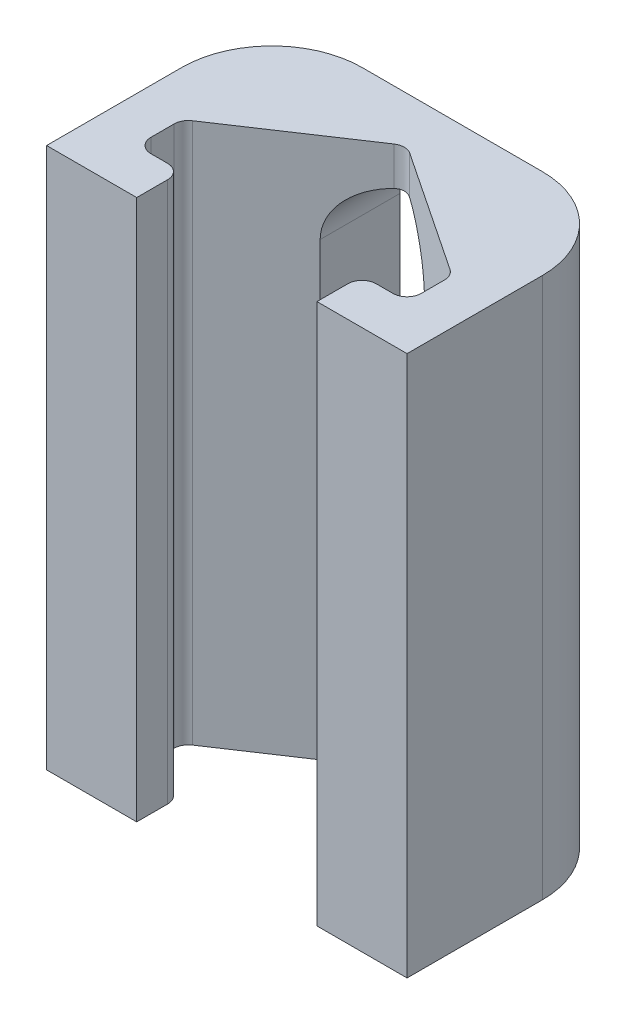
from build123d import *

# Parameters (mm, degrees)
BOSS_EXTRUDE1_DEPTH     = 127
BOSS_EXTRUDE2_DEPTH     = 38.1
FILLET1_R               = 1
CUT_EXTRUDE1_DEPTH      = 166.676690047
CUT_EXTRUDE1_DEPTH_BACK = 166.676690047


with BuildPart() as part:
    # Sketch2 → Boss-Extrude1 (new body)
    with BuildSketch(Plane.XY):
        with BuildLine():
            Line((-71.414284285, -70), (71.414284285, -70))
            ThreePointArc((71.414284285, -70), (0, -100), (-71.414284285, -70))
        make_face()
    extrude(amount=BOSS_EXTRUDE1_DEPTH)


with BuildPart() as body_2:
    # Sketch3 → Boss-Extrude2 (new body)
    with BuildSketch(Plane(origin=(0, 0, 0), x_dir=(1, 0, 0), z_dir=(0, 1, 0))):
        with BuildLine():
            Line((-52.364284285, -127), (-52.364284285, -117.475))
            ThreePointArc((-52.364284285, -117.475), (-50.504412346, -112.984871939), (-46.014284285, -111.125))
            Line((-46.014284285, -111.125), (-33.314284285, -111.125))
            ThreePointArc((-33.314284285, -111.125), (-28.824156225, -112.984871939), (-26.964284285, -117.475))
            Line((-26.964284285, -117.475), (-26.964284285, -127))
            Line((-26.964284285, -127), (-33.314284285, -127))
            Line((-33.314284285, -127), (-33.314284285, -123.825))
            Line((-33.314284285, -123.825), (-30.139284285, -123.825))
            Line((-30.139284285, -123.825), (-30.139284285, -120.65))
            Line((-30.139284285, -120.65), (-39.664284285, -114.3))
            Line((-39.664284285, -114.3), (-49.189284285, -120.65))
            Line((-49.189284285, -120.65), (-49.189284285, -123.825))
            Line((-49.189284285, -123.825), (-46.014284285, -123.825))
            Line((-46.014284285, -123.825), (-46.014284285, -127))
            Line((-46.014284285, -127), (-52.364284285, -127))
        make_face()
    extrude(amount=BOSS_EXTRUDE2_DEPTH)

    # Fillet1
    fillet1_edges = [body_2.edges().sort_by_distance(p)[0] for p in [
        (-46.014284285, 19.05, 123.825),
        (-33.314284285, 19.05, 123.825),
        (-30.139284285, 19.05, 123.825),
        (-30.139284285, 19.05, 120.65),
        (-39.664284285, 19.05, 114.3),
        (-49.189284285, 19.05, 120.65),
        (-49.189284285, 19.05, 123.825),
    ]]
    fillet(fillet1_edges, radius=FILLET1_R)

    # Sketch5 → Cut-Extrude1 (cut, two sides: drawn at the far end of the back side and taken through both)
    with BuildSketch(Plane(origin=(0, 0, 111.125), x_dir=(-1, 0, 0), z_dir=(0, 0, -1)).offset(-CUT_EXTRUDE1_DEPTH_BACK)):
        with BuildLine():
            Line((43.339284285, 31.75), (43.339284285, 6.35))
            ThreePointArc((43.339284285, 6.35), (39.664284285, 2.675), (35.989284285, 6.35))
            Line((35.989284285, 6.35), (35.989284285, 31.75))
            ThreePointArc((35.989284285, 31.75), (39.664284285, 35.425), (43.339284285, 31.75))
        make_face()
    extrude(amount=CUT_EXTRUDE1_DEPTH + CUT_EXTRUDE1_DEPTH_BACK, mode=Mode.SUBTRACT)


solid = body_2.part
